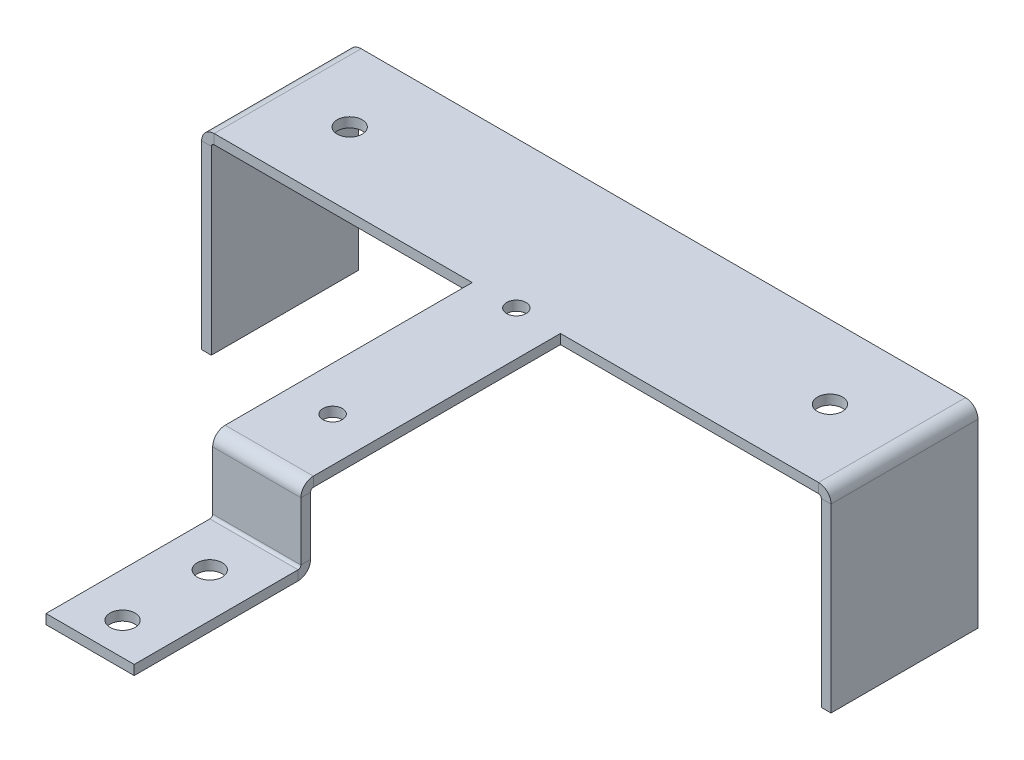
from build123d import *

# Parameters (mm, degrees)
BASE_FLANGE1_DEPTH      = 25.4
BASE_FLANGE2_DEPTH      = 7.62
BASE_FLANGE2_DEPTH_BACK = 7.62
SKETCH9_R               = 2.159
CUT_EXTRUDE1_DEPTH      = 1.6764
SKETCH12_R              = 1.6764
SKETCH12_R_2            = 2.159
CUT_EXTRUDE4_DEPTH      = 1.6764
CUT_EXTRUDE5_DEPTH      = 2.54


# Sheet-metal steps are written as plain solids
with BuildPart() as part:
    # Sketch1 → Base-Flange1 (new body)
    with BuildSketch(Plane.XY):
        with BuildLine():
            Line((-52.705, -15.875), (-52.705, 15.3924))
            ThreePointArc((-52.705, 15.3924), (-52.563649733, 15.733649733), (-52.2224, 15.875))
            Line((-52.2224, 15.875), (52.2224, 15.875))
            ThreePointArc((52.2224, 15.875), (52.563649733, 15.733649733), (52.705, 15.3924))
            Line((52.705, 15.3924), (52.705, -15.875))
            Line((52.705, -15.875), (54.3814, -15.875))
            Line((54.3814, -15.875), (54.3814, 15.3924))
            ThreePointArc((54.3814, 15.3924), (53.749043541, 16.919043541), (52.2224, 17.5514))
            Line((52.2224, 17.5514), (-52.2224, 17.5514))
            ThreePointArc((-52.2224, 17.5514), (-53.749043541, 16.919043541), (-54.3814, 15.3924))
            Line((-54.3814, 15.3924), (-54.3814, -15.875))
            Line((-54.3814, -15.875), (-52.705, -15.875))
        make_face()
    extrude(amount=BASE_FLANGE1_DEPTH)


with BuildPart() as body_2:
    # Sketch6 → Base-Flange2 (new, two sides: drawn at the far end of the back side and taken through both)
    with BuildSketch(Plane(origin=(0, 0, 0), x_dir=(0, 0, -1), z_dir=(1, 0, 0)).offset(-BASE_FLANGE2_DEPTH_BACK)):
        with BuildLine():
            Line((-25.4, 15.875), (-68.0974, 15.875))
            ThreePointArc((-68.0974, 15.875), (-68.438649733, 15.733649733), (-68.58, 15.3924))
            Line((-68.58, 15.3924), (-68.58, 5.334))
            ThreePointArc((-68.58, 5.334), (-69.212356459, 3.807356459), (-70.739, 3.175))
            Line((-70.739, 3.175), (-99.06, 3.175))
            Line((-99.06, 3.175), (-99.06, 4.8514))
            Line((-99.06, 4.8514), (-70.739, 4.8514))
            ThreePointArc((-70.739, 4.8514), (-70.397750267, 4.992750267), (-70.2564, 5.334))
            Line((-70.2564, 5.334), (-70.2564, 15.3924))
            ThreePointArc((-70.2564, 15.3924), (-69.624043541, 16.919043541), (-68.0974, 17.5514))
            Line((-68.0974, 17.5514), (-25.4, 17.5514))
            Line((-25.4, 17.5514), (-25.4, 15.875))
        make_face()
    extrude(amount=BASE_FLANGE2_DEPTH + BASE_FLANGE2_DEPTH_BACK)

    # Sketch9 → Cut-Extrude1 (cut)
    with BuildSketch(Plane(origin=(0, 4.8514, 0), x_dir=(1, 0, 0), z_dir=(0, 1, 0))):
        with Locations(Location((0, -78.3844, 0), (0, 0, 270))):
            Circle(SKETCH9_R)
        with Locations(Location((0, -93.4466, 0), (0, 0, 270))):
            Circle(SKETCH9_R)
    extrude(amount=-CUT_EXTRUDE1_DEPTH, mode=Mode.SUBTRACT)


with BuildPart() as cut_extrude4_tool:
    # Sketch12 → Cut-Extrude4 (new body)
    with BuildSketch(Plane(origin=(0, 17.5514, 0), x_dir=(1, 0, 0), z_dir=(0, 1, 0))):
        with Locations(Location((0, -57.15, 0), (0, 0, 270))):
            Circle(SKETCH12_R)
        with Locations(Location((-41.49725, -12.7, 0), (0, 0, 270))):
            Circle(SKETCH12_R_2)
        with Locations(Location((41.49725, -12.7, 0), (0, 0, 270))):
            Circle(SKETCH12_R_2)
    extrude(amount=-CUT_EXTRUDE4_DEPTH)


with BuildPart() as part_1:
    add(part.part)

    # Cut-Extrude4: cut by cut_extrude4_tool
    add(cut_extrude4_tool.part, mode=Mode.SUBTRACT)


with BuildPart() as body_2_1:
    add(body_2.part)

    # Cut-Extrude4: cut by cut_extrude4_tool
    add(cut_extrude4_tool.part, mode=Mode.SUBTRACT)


with BuildPart() as cut_extrude5_tool:
    # Sketch12<3> → Cut-Extrude5 (new body)
    with BuildSketch(Plane(origin=(0, 17.5514, 0), x_dir=(1, 0, 0), z_dir=(0, 1, 0))):
        with BuildLine():
            Line((-1.6764, -25.4), (1.6764, -25.4))
            ThreePointArc((1.6764, -25.4), (0, -23.7236), (-1.6764, -25.4))
        make_face()
        with BuildLine():
            ThreePointArc((-1.6764, -25.4), (0, -27.0764), (1.6764, -25.4))
            Line((1.6764, -25.4), (-1.6764, -25.4))
        make_face()
    extrude(amount=-CUT_EXTRUDE5_DEPTH)


with BuildPart() as part_2:
    add(part_1.part)

    # Cut-Extrude5: cut by cut_extrude5_tool
    add(cut_extrude5_tool.part, mode=Mode.SUBTRACT)


with BuildPart() as body_2_2:
    add(body_2_1.part)

    # Cut-Extrude5: cut by cut_extrude5_tool
    add(cut_extrude5_tool.part, mode=Mode.SUBTRACT)

    # Combine1: union part
    add(part_2.part)


solid = body_2_2.part
